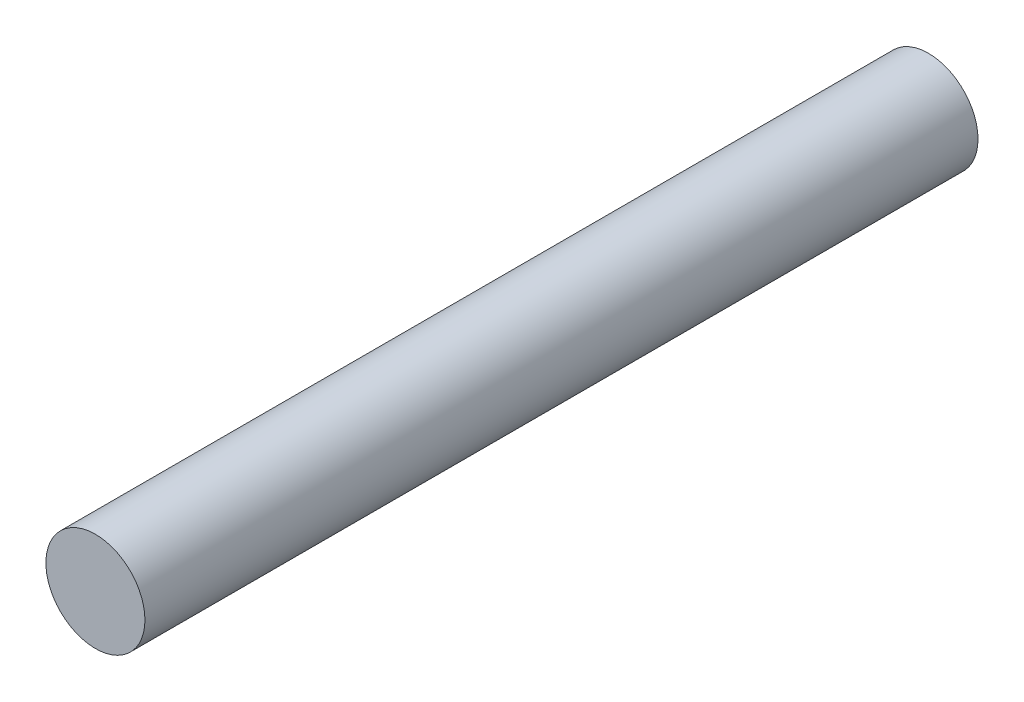
from build123d import *

# Parameters (mm, degrees)
SKETCH2_W = 4
SKETCH2_H = 67.3


with BuildPart() as part:
    # Sketch2 → Revolve1 (revolve)
    with BuildSketch(Plane(origin=(0, 0, 0), x_dir=(1, 0, 0), z_dir=(0, 1, 0))):
        with Locations((2, -33.65)):
            Rectangle(SKETCH2_W, SKETCH2_H)
    revolve(axis=Axis((0, 0, 25.914367816), (0, 0, -1)))


solid = part.part
